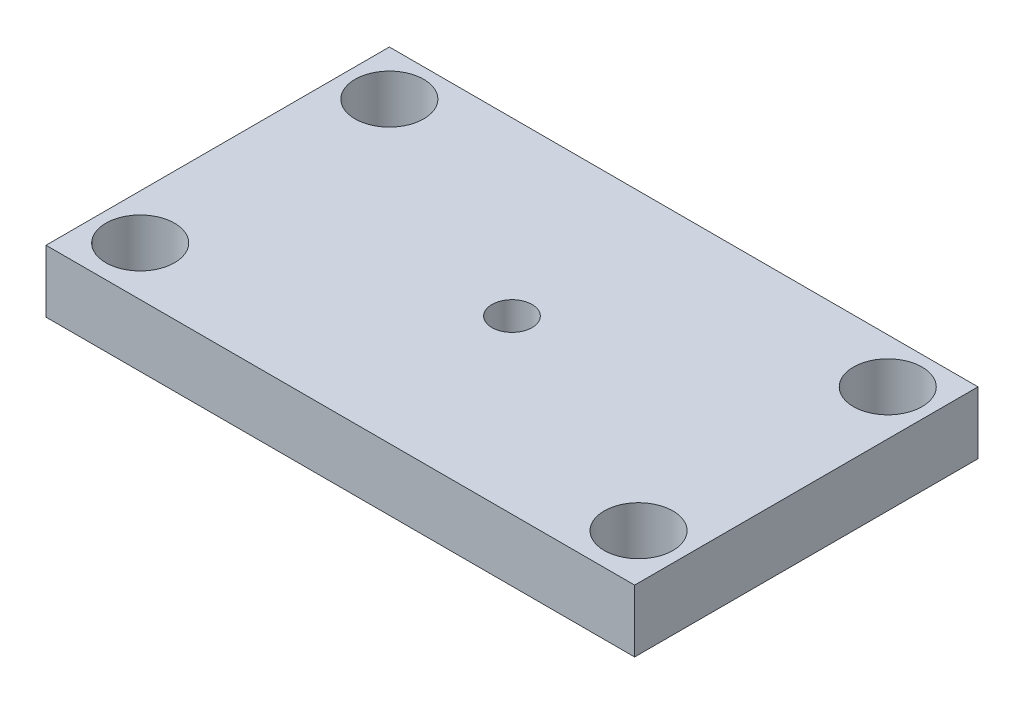
from build123d import *

# Parameters (mm, degrees)
SKETCH1_W           = 60
SKETCH1_H           = 35
SKETCH1_R           = 3.5
SKETCH1_R_2         = 2.0447
BOSS_EXTRUDE1_DEPTH = 6.35


with BuildPart() as part:
    # Sketch1 → Boss-Extrude1 (new body)
    with BuildSketch(Plane(origin=(0, 0, 0), x_dir=(1, 0, 0), z_dir=(0, 1, 0))):
        with Locations((30, 17.5)):
            Rectangle(SKETCH1_W, SKETCH1_H)
        with Locations((4.6, 30.4)):
            Circle(SKETCH1_R, mode=Mode.SUBTRACT)
        with Locations((55.4, 30.4)):
            Circle(SKETCH1_R, mode=Mode.SUBTRACT)
        with Locations((4.6, 5)):
            Circle(SKETCH1_R, mode=Mode.SUBTRACT)
        with Locations((55.4, 5)):
            Circle(SKETCH1_R, mode=Mode.SUBTRACT)
        with Locations((30, 17.5)):
            Circle(SKETCH1_R_2, mode=Mode.SUBTRACT)
    extrude(amount=BOSS_EXTRUDE1_DEPTH)


solid = part.part
